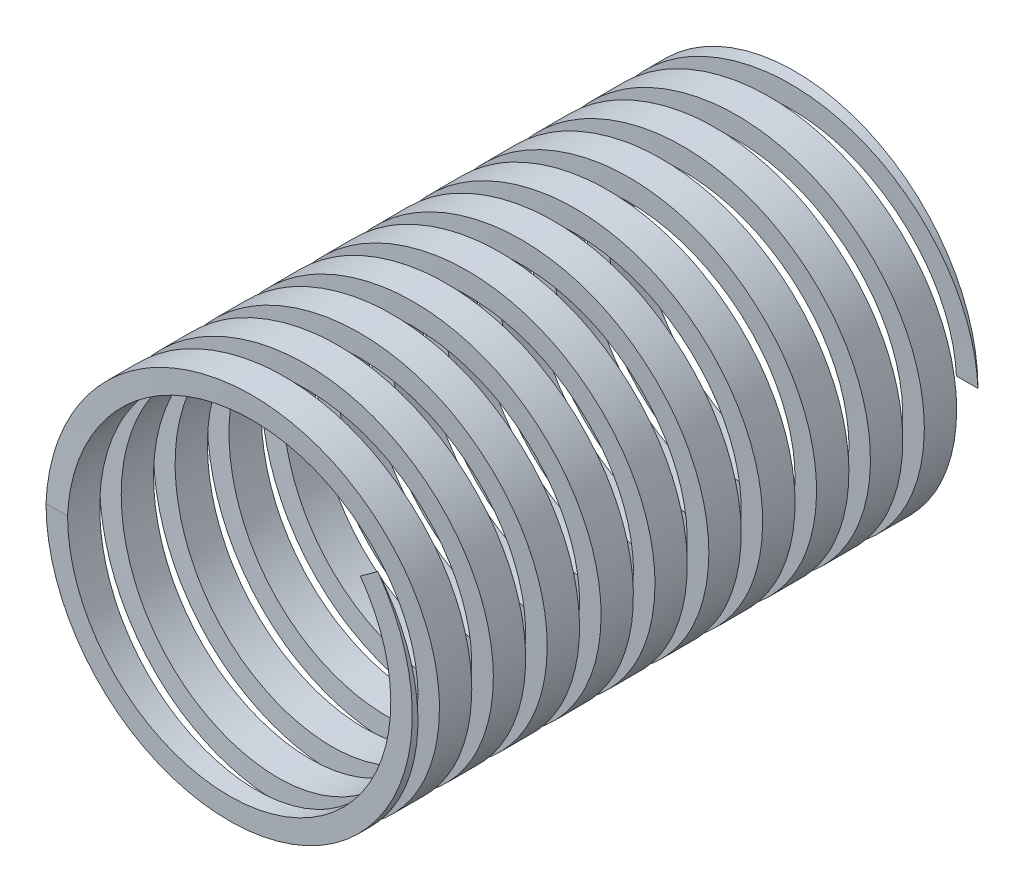
from build123d import *

# Parameters (mm, degrees)
SKICA1_R                         = 1.7
SKICA1_R_2                       = 1.5
P_IDAT_VYSUNUT_M1_DEPTH          = 5.25
ODEBRAT_TA_EN_M_PO_K_IVCE1_PITCH = 0.5


with BuildPart() as part:
    # Skica1 → Přidat vysunutím1 (new body)
    with BuildSketch(Plane.XY):
        with Locations(Location((0, 0, 0), (0, 0, 180))):
            Circle(SKICA1_R)
        with Locations(Location((0, 0, 0), (0, 0, 180))):
            Circle(SKICA1_R_2, mode=Mode.SUBTRACT)
    extrude(amount=P_IDAT_VYSUNUT_M1_DEPTH)

    # Odebrat tažením po křivce1: arcs per turn and ends read off the stored shape
    # Odebrat tažením po křivce1: the profile of Skica4 profile screwed along a right-hand helix through 13.5 turns, 6 arcs to a turn; built about Z, then put on its axis
    odebrat_ta_en_m_po_k_ivce1_z = Axis((0, 0, 0), (0, 0, 1))
    odebrat_ta_en_m_po_k_ivce1_corners = [(1.7003, 0, -0.5), (1.45, 0, -0.5), (1.45, 0, -0.3), (1.7003, 0, -0.3)]
    with BuildLine(mode=Mode.PRIVATE) as odebrat_ta_en_m_po_k_ivce1_profile:
        Line(odebrat_ta_en_m_po_k_ivce1_corners[0], odebrat_ta_en_m_po_k_ivce1_corners[1])
        Line(odebrat_ta_en_m_po_k_ivce1_corners[1], odebrat_ta_en_m_po_k_ivce1_corners[2])
        Line(odebrat_ta_en_m_po_k_ivce1_corners[2], odebrat_ta_en_m_po_k_ivce1_corners[3])
        Line(odebrat_ta_en_m_po_k_ivce1_corners[3], odebrat_ta_en_m_po_k_ivce1_corners[0])
    odebrat_ta_en_m_po_k_ivce1_cap = Face(odebrat_ta_en_m_po_k_ivce1_profile.wire())
    odebrat_ta_en_m_po_k_ivce1_turn_angles = [0, 30, 60, 90, 120, 150, 180, 210, 240, 270, 300, 330, 360]
    odebrat_ta_en_m_po_k_ivce1_turn_weights = [1, 0.8660254037844387, 1, 0.8660254037844387, 1, 0.8660254037844387, 1, 0.8660254037844387, 1, 0.8660254037844387, 1, 0.8660254037844387, 1]
    odebrat_ta_en_m_po_k_ivce1_turn_rails = [Edge.make_bspline([Vector(p[0], p[1], 0).rotate(odebrat_ta_en_m_po_k_ivce1_z, odebrat_ta_en_m_po_k_ivce1_turn_angles[k]) / odebrat_ta_en_m_po_k_ivce1_turn_weights[k] + Vector(0, 0, p[2] + ODEBRAT_TA_EN_M_PO_K_IVCE1_PITCH * odebrat_ta_en_m_po_k_ivce1_turn_angles[k] / 360) for k in range(13)], [0, 0, 0, 1, 1, 2, 2, 3, 3, 4, 4, 5, 5, 6, 6, 6], 2, odebrat_ta_en_m_po_k_ivce1_turn_weights) for p in odebrat_ta_en_m_po_k_ivce1_corners]
    odebrat_ta_en_m_po_k_ivce1_turn_sides = [Face.make_surface_from_curves(odebrat_ta_en_m_po_k_ivce1_turn_rails[p[0]], odebrat_ta_en_m_po_k_ivce1_turn_rails[p[1]]) for p in [(0, 1), (1, 2), (2, 3), (3, 0)]]
    odebrat_ta_en_m_po_k_ivce1_last_angles = [4680, 4710, 4740, 4770, 4800, 4830, 4860]
    odebrat_ta_en_m_po_k_ivce1_last_weights = [1, 0.8660254037844387, 1, 0.8660254037844387, 1, 0.8660254037844387, 1]
    odebrat_ta_en_m_po_k_ivce1_last_rails = [Edge.make_bspline([Vector(p[0], p[1], 0).rotate(odebrat_ta_en_m_po_k_ivce1_z, odebrat_ta_en_m_po_k_ivce1_last_angles[k]) / odebrat_ta_en_m_po_k_ivce1_last_weights[k] + Vector(0, 0, p[2] + ODEBRAT_TA_EN_M_PO_K_IVCE1_PITCH * odebrat_ta_en_m_po_k_ivce1_last_angles[k] / 360) for k in range(7)], [0, 0, 0, 1, 1, 2, 2, 3, 3, 3], 2, odebrat_ta_en_m_po_k_ivce1_last_weights) for p in odebrat_ta_en_m_po_k_ivce1_corners]
    odebrat_ta_en_m_po_k_ivce1_last_sides = [Face.make_surface_from_curves(odebrat_ta_en_m_po_k_ivce1_last_rails[p[0]], odebrat_ta_en_m_po_k_ivce1_last_rails[p[1]]) for p in [(0, 1), (1, 2), (2, 3), (3, 0)]]
    odebrat_ta_en_m_po_k_ivce1 = Plane(origin=(0, 0, 0), x_dir=(1, 0, 0), z_dir=(0, 0, 1)) * Solid(Shell([*[p.moved(Location((0, 0, ODEBRAT_TA_EN_M_PO_K_IVCE1_PITCH * i))) for i in range(13) for p in odebrat_ta_en_m_po_k_ivce1_turn_sides], *odebrat_ta_en_m_po_k_ivce1_last_sides, odebrat_ta_en_m_po_k_ivce1_cap, odebrat_ta_en_m_po_k_ivce1_cap.rotate(odebrat_ta_en_m_po_k_ivce1_z, 4860).moved(Location((0, 0, ODEBRAT_TA_EN_M_PO_K_IVCE1_PITCH * 4860 / 360)))]))
    add(odebrat_ta_en_m_po_k_ivce1, mode=Mode.SUBTRACT)


solid = part.part
